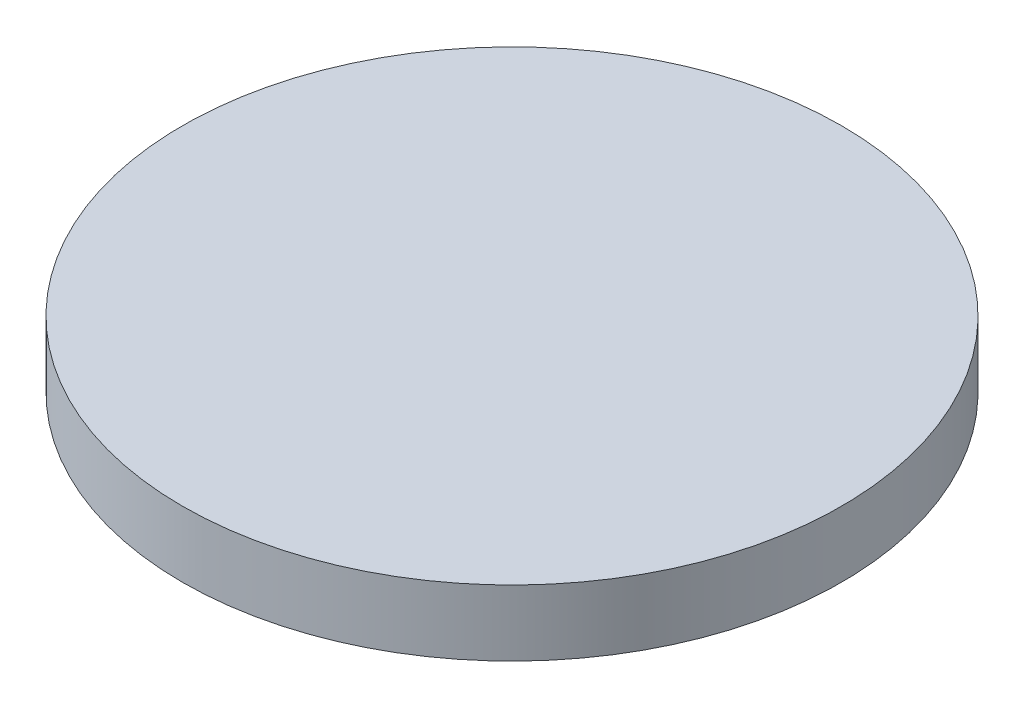
from build123d import *

# Parameters (mm, degrees)
SKETCH1_R           = 50
BOSS_EXTRUDE1_DEPTH = 10


with BuildPart() as part:
    # Sketch1 → Boss-Extrude1 (new body)
    with BuildSketch(Plane(origin=(0, 0, 0), x_dir=(1, 0, 0), z_dir=(0, 1, 0))):
        Circle(SKETCH1_R)
    extrude(amount=BOSS_EXTRUDE1_DEPTH)


solid = part.part
